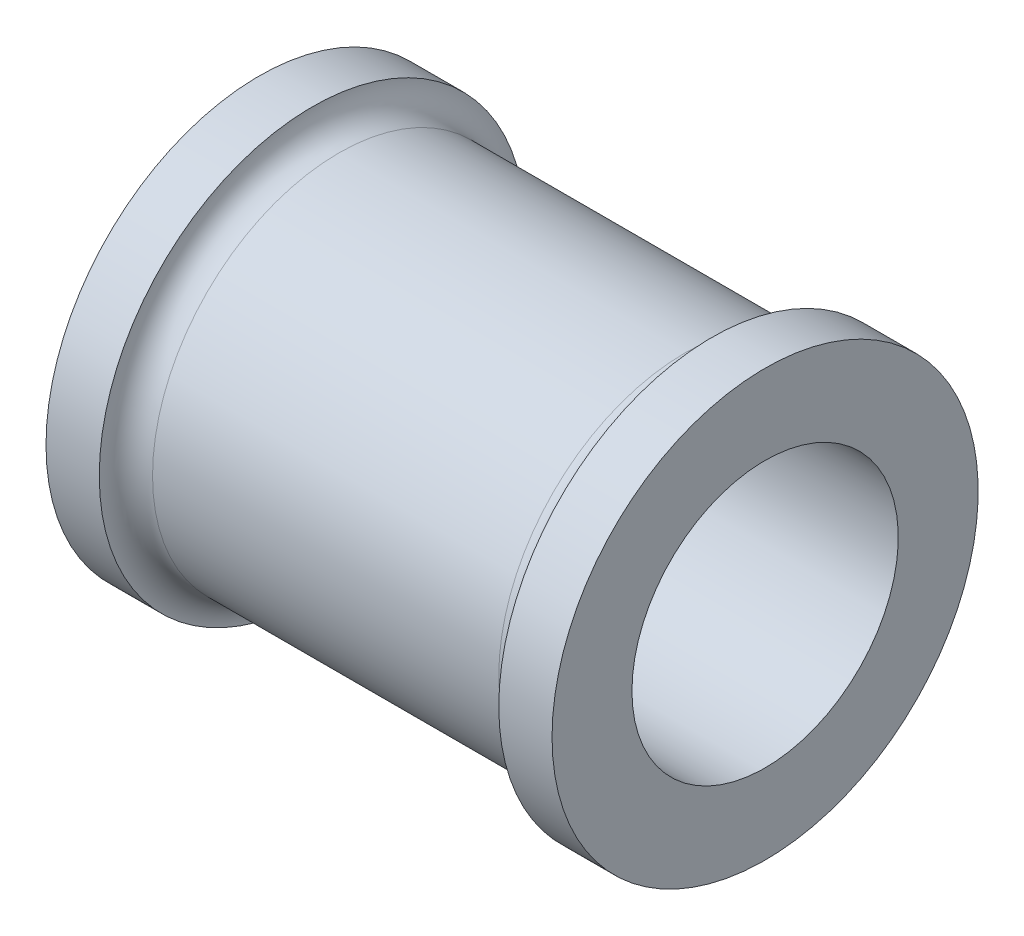
from build123d import *

# Parameters (mm, degrees)
FILLET1_R = 1


with BuildPart() as part:
    # Sketch1 → Revolve1 (revolve)
    with BuildSketch(Plane(origin=(0, 0, 0), x_dir=(1, 0, 0), z_dir=(0, 1, 0)), mode=Mode.PRIVATE) as revolve1_sk:
        Polygon((0, 7), (15, 7), (15, 8), (17, 8), (17, 5), (-2, 5), (-2, 8), (0, 8), align=None)
    revolve(revolve1_sk.sketch.rotate(Axis((0, 0, 0), (1, 0, 0)), 180), axis=Axis((0, 0, 0), (1, 0, 0)))

    # Fillet1
    fillet1_edges = [part.edges().sort_by_distance(p)[0] for p in [
        (0, 0, -7),
        (15, 0, -7),
    ]]
    fillet(fillet1_edges, radius=FILLET1_R - 0.0001)  # a hair under: the kernel refuses the full size


solid = part.part
